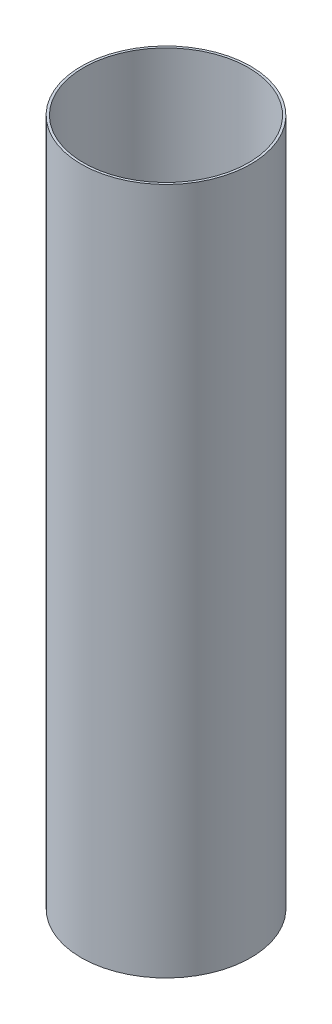
from build123d import *

# Parameters (mm, degrees)
SKETCH1_R       = 78.359
SKETCH1_R_2     = 76.2
F_25_TUBE_DEPTH = 635


with BuildPart() as part:
    # Sketch1 → 25" Tube (new body)
    with BuildSketch(Plane(origin=(0, 0, 0), x_dir=(1, 0, 0), z_dir=(0, 1, 0))):
        Circle(SKETCH1_R)
        Circle(SKETCH1_R_2, mode=Mode.SUBTRACT)
    extrude(amount=F_25_TUBE_DEPTH)


solid = part.part
